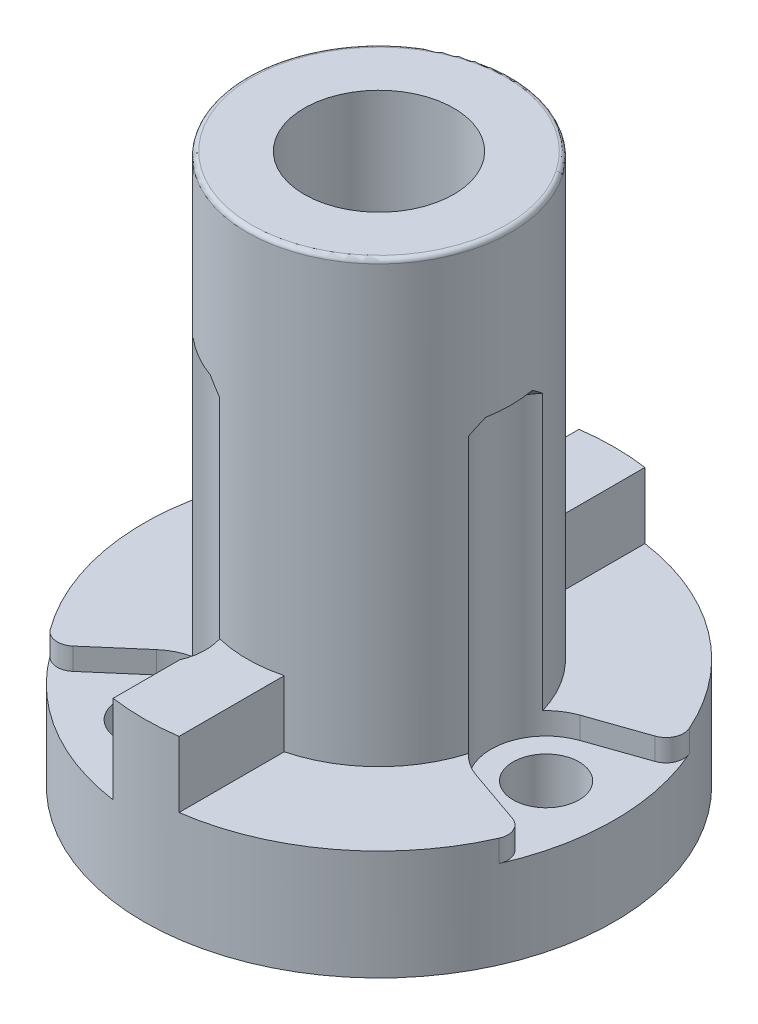
from build123d import *
from build123d.topology import SkipClean

# Parameters (mm, degrees)
SKETCH1_R           = 5.35
BOSS_EXTRUDE1_DEPTH = 2.5
HOLE1_OUTLINE_R     = 1.7
HOLE1_DEPTH         = 2.5
SKETCH3_R           = 3
SKETCH3_R_2         = 1.7
BOSS_EXTRUDE2_DEPTH = 10
FILLET1_R           = 0.1
BOSS_EXTRUDE3_DEPTH = 1.5
SKETCH8_R           = 0.75
CUT_EXTRUDE1_DEPTH  = 13.539736839
CUT_EXTRUDE3_START  = -0.5
SKETCH13_R          = 1.25
CUT_EXTRUDE3_DEPTH  = 7
CHAMFER1_SIZE       = 0.25
CUT_EXTRUDE4_START  = -0.5
CUT_EXTRUDE4_DEPTH  = 0.5
FILLET2_R           = 0.4


# Read off the part's stored shape, not the designer's step: Hole1
with BuildPart() as part:
    # Sketch1 → Boss-Extrude1 (new body)
    with BuildSketch(Plane(origin=(0, 0, 0), x_dir=(1, 0, 0), z_dir=(0, 1, 0))):
        with Locations(Location((0, 0, 0), (0, 0, 270))):
            Circle(SKETCH1_R)
    extrude(amount=BOSS_EXTRUDE1_DEPTH)

    # Hole1 outline → Hole1 (cut)
    with BuildSketch(Plane(origin=(0, 0, 0), x_dir=(1, 0, 0), z_dir=(0, 1, 0))):
        Circle(HOLE1_OUTLINE_R)
    extrude(amount=HOLE1_DEPTH, mode=Mode.SUBTRACT)

    # Sketch3 → Boss-Extrude2 (add)
    with BuildSketch(Plane(origin=(0, 2.5, 0), x_dir=(1, 0, 0), z_dir=(0, 1, 0))):
        with Locations(Location((0, 0, 0), (0, 0, 270))):
            Circle(SKETCH3_R)
        with Locations(Location((0, 0, 0), (0, 0, 270))):
            Circle(SKETCH3_R_2, mode=Mode.SUBTRACT)
    extrude(amount=BOSS_EXTRUDE2_DEPTH)

    # Fillet1
    fillet1_edges = [part.edges().sort_by_distance(p)[0] for p in [
        (0, 12.5, -3),
    ]]
    fillet(fillet1_edges, radius=FILLET1_R)

    # Sketch5 → Boss-Extrude3 (add)
    with BuildSketch(Plane(origin=(0, 2.5, 0), x_dir=(1, 0, 0), z_dir=(0, 1, 0))):
        with BuildLine():
            Line((-0.75, 5.297169055), (-0.75, 2.90473751))
            ThreePointArc((-0.75, 2.90473751), (0, 3), (0.75, 2.90473751))
            Line((0.75, 2.90473751), (0.75, 5.297169055))
            ThreePointArc((0.75, 5.297169055), (0, 5.35), (-0.75, 5.297169055))
        make_face()
    boss_extrude3 = extrude(amount=BOSS_EXTRUDE3_DEPTH)

    # Mirror1: Boss-Extrude3 across plane
    with SkipClean():  # the faces are left unmerged after this step: merging them gives an invalid solid
        add(boss_extrude3.mirror(Plane.XY))

    # Sketch8 → Cut-Extrude1 (cut, through all)
    with SkipClean():  # the faces are left unmerged after this step: merging them gives an invalid solid
        with BuildSketch(Plane(origin=(0, 2.5, 0), x_dir=(1, 0, 0), z_dir=(0, 1, 0))):
            with Locations(Location((3.8, 0, 0), (0, 0, 270))):
                Circle(SKETCH8_R)
            with Locations(Location((-1.9, -3.290896534, 0), (0, 0, 270))):
                Circle(SKETCH8_R)
            with Locations(Location((-1.9, 3.290896534, 0), (0, 0, 270))):
                Circle(SKETCH8_R)
        extrude(amount=-CUT_EXTRUDE1_DEPTH, mode=Mode.SUBTRACT)

    # Sketch13 → Cut-Extrude3 (cut)
    with SkipClean():  # the faces are left unmerged after this step: merging them gives an invalid solid
        with BuildSketch(Plane(origin=(0, 2.5, 0), x_dir=(1, 0, 0), z_dir=(0, 1, 0)).offset(CUT_EXTRUDE3_START)):
            with Locations(Location((-1.9, 3.290896534, 0), (0, 0, 23.073918066))):
                Circle(SKETCH13_R)
            with Locations(Location((-1.9, -3.290896534, 0), (0, 0, 102.514591278))):
                Circle(SKETCH13_R)
            with Locations(Location((3.8, 0, 0), (0, 0, 137.485408722))):
                Circle(SKETCH13_R)
        extrude(amount=CUT_EXTRUDE3_DEPTH, mode=Mode.SUBTRACT)

    # Chamfer1
    chamfer1_edges = [part.edges().sort_by_distance(p)[0] for p in [
        (-1.275, 9, -2.20836478),
        (-1.275, 9, 2.20836478),
        (2.55, 9, 0),
    ]]
    chamfer(chamfer1_edges, length=CHAMFER1_SIZE)

    # Sketch14 → Cut-Extrude4 (cut)
    with BuildSketch(Plane(origin=(0, 2.5, 0), x_dir=(1, 0, 0), z_dir=(0, 1, 0)).offset(CUT_EXTRUDE4_START)):
        with BuildLine():
            Line((-0.75, -3.780794483), (-0.75, -5.297169055))
            ThreePointArc((-0.75, -5.297169055), (-2.563606422, -4.695787699), (-4.050222345, -3.495454041))
            Line((-4.050222345, -3.495454041), (-2.716694869, -2.344582902))
            ThreePointArc((-2.716694869, -2.344582902), (-2.637189937, -4.300377092), (-0.75, -3.780794483))
        make_face()
        with BuildLine():
            Line((-0.75, 5.297169055), (-0.75, 3.780794483))
            ThreePointArc((-0.75, 3.780794483), (-2.637189937, 4.300377092), (-2.716694869, 2.344582902))
            Line((-2.716694869, 2.344582902), (-4.050222345, 3.495454041))
            ThreePointArc((-4.050222345, 3.495454041), (-2.563606422, 4.695787699), (-0.75, 5.297169055))
        make_face()
        with BuildLine():
            Line((3.388815789, -1.18043532), (5.05226317, -1.759868421))
            ThreePointArc((5.05226317, -1.759868421), (5.35, 0), (5.05226317, 1.759868421))
            Line((5.05226317, 1.759868421), (3.388815789, 1.18043532))
            ThreePointArc((3.388815789, 1.18043532), (5.05, 0), (3.388815789, -1.18043532))
        make_face()
    extrude(amount=CUT_EXTRUDE4_DEPTH, mode=Mode.SUBTRACT)

    # Fillet2
    fillet2_edges = [part.edges().sort_by_distance(p)[0] for p in [
        (-4.050222345, 2.25, -3.495454041),
        (-4.050222345, 2.25, 3.495454041),
        (5.05226317, 2.25, -1.759868421),
        (5.05226317, 2.25, 1.759868421),
    ]]
    fillet(fillet2_edges, radius=FILLET2_R)


solid = part.part
